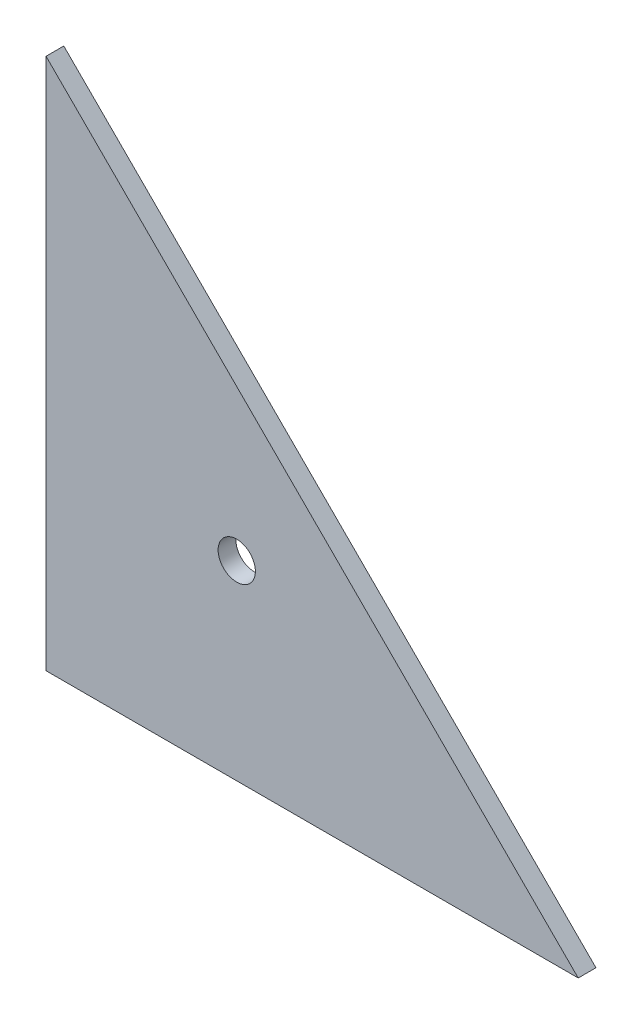
from build123d import *

# Parameters (mm, degrees)
SKETCH_1_R             = 2.1
SM_BASE_FLANGE_1_DEPTH = 2


# Sheet-metal steps are written as plain solids
with BuildPart() as part:
    # Sketch 1 → 基体-法兰1 (new body)
    with BuildSketch(Plane.XY):
        Polygon((0, 0), (0, 60), (60, 0), align=None)
        with Locations((21.5, 21.5)):
            Circle(SKETCH_1_R, mode=Mode.SUBTRACT)
    extrude(amount=-SM_BASE_FLANGE_1_DEPTH)


solid = part.part
